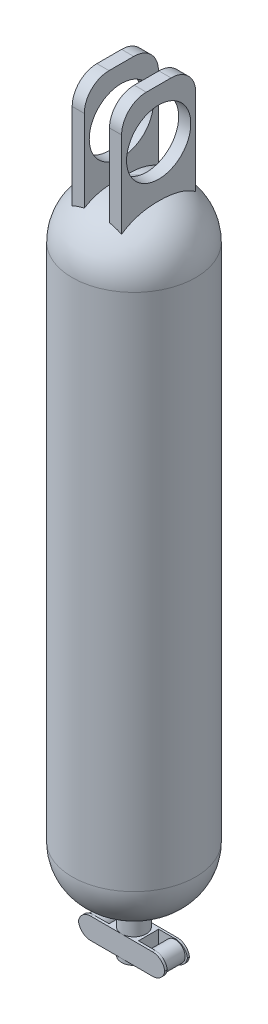
from build123d import *

# Parameters (mm, degrees)
SKETCH1_R           = 2.5
BOSS_EXTRUDE1_DEPTH = 25
SKETCH2_W           = 2
SKETCH2_H           = 3
SKETCH2_W_2         = 1
SKETCH2_H_2         = 2
BOSS_EXTRUDE2_DEPTH = 4
SKETCH3_W           = 1.019035956
SKETCH3_H           = 3.229242318
CUT_EXTRUDE1_DEPTH  = 4
SKETCH4_R           = 1.3
CUT_EXTRUDE2_DEPTH  = 4
FILLET1_R           = 1
FILLET2_R           = 2
SKETCH5_R           = 0.5
BOSS_EXTRUDE3_DEPTH = 2
SKETCH6_W           = 3.503526818
SKETCH6_H           = 0.85884316
BOSS_EXTRUDE4_DEPTH = 0.5
FILLET3_R           = 0.5
SKETCH7_W           = 0.309208581
SKETCH7_H           = 0.81541506
CUT_EXTRUDE6_DEPTH  = 1
LPATTERN1_COUNT     = 2
LPATTERN1_PITCH     = 1.5
FILLET4_R           = 0.5
CUT_EXTRUDE8_DEPTH  = 1
CUT_EXTRUDE9_DEPTH  = 1
SKETCH12_R          = 0.4
BOSS_EXTRUDE5_DEPTH = 1
SKETCH13_R          = 0.4
BOSS_EXTRUDE6_DEPTH = 1


with BuildPart() as part:
    # Sketch1 → Boss-Extrude1 (new body)
    with BuildSketch(Plane(origin=(0, 0, 0), x_dir=(1, 0, 0), z_dir=(0, 1, 0))):
        with Locations(Location((0, 0, 0), (0, 0, 270))):
            Circle(SKETCH1_R)
    extrude(amount=BOSS_EXTRUDE1_DEPTH)

    # Sketch2 → Boss-Extrude2 (add)
    with BuildSketch(Plane(origin=(0, 25, 0), x_dir=(1, 0, 0), z_dir=(0, 1, 0))):
        Rectangle(SKETCH2_W, SKETCH2_H)
        Rectangle(SKETCH2_W_2, SKETCH2_H_2, mode=Mode.SUBTRACT)
    extrude(amount=BOSS_EXTRUDE2_DEPTH)

    # Sketch3 → Cut-Extrude1 (cut)
    with BuildSketch(Plane(origin=(0, 29, 0), x_dir=(1, 0, 0), z_dir=(0, 1, 0))):
        Rectangle(SKETCH3_W, SKETCH3_H)
    extrude(amount=-CUT_EXTRUDE1_DEPTH, mode=Mode.SUBTRACT)

    # Sketch4 → Cut-Extrude2 (cut)
    with BuildSketch(Plane.ZY.offset(1)):
        with Locations((0, 27)):
            Circle(SKETCH4_R)
    extrude(amount=-CUT_EXTRUDE2_DEPTH, mode=Mode.SUBTRACT)

    # Fillet1
    fillet1_edges = [part.edges().sort_by_distance(p)[0] for p in [
        (-0.754758989, 29, 1.5),
        (0.754758989, 29, -1.5),
        (-0.754758989, 29, -1.5),
        (0.754758989, 29, 1.5),
    ]]
    fillet(fillet1_edges, radius=FILLET1_R)

    # Fillet2
    # the kernel refuses this fillet: 2 mm, written as the material it takes off along each edge
    with BuildSketch(Plane(origin=(0, 0, 0), x_dir=(0, 0, 1), z_dir=(-1, 0, 0))) as fillet2_piece_1:
        with BuildLine():
            CenterArc((2.5 - FILLET2_R, FILLET2_R), FILLET2_R, 270, 90)
            Line((2.5 - FILLET2_R, 0), (2.5, 0))
            Line((2.5, 0), (2.5, FILLET2_R))
        make_face()
    revolve(axis=Axis((0, 0, 0), (0, 1, 0)), mode=Mode.SUBTRACT)
    with BuildSketch(Plane(origin=(0, 25, 0), x_dir=(0, 0, 1), z_dir=(-1, 0, 0))) as fillet2_piece_2_section:
        with BuildLine():
            CenterArc((2.5 - FILLET2_R, -FILLET2_R), FILLET2_R, 0, 90)
            Line((2.5, -FILLET2_R), (2.5, 0))
            Line((2.5, 0), (2.5 - FILLET2_R, 0))
        make_face()
    fillet2_piece_2 = revolve(axis=Axis((0, 25, 0), (0, 1, 0)), mode=Mode.PRIVATE)
    fillet2_piece_2 = split(fillet2_piece_2, bisect_by=Plane(origin=(0.509517978, 24.924108372, -1.066767337), z_dir=(-1, 0, 0)), keep=Keep.TOP, mode=Mode.PRIVATE)
    fillet2_piece_2 = split(fillet2_piece_2, bisect_by=Plane(origin=(-0.509517978, 24.924108372, -1.066767337), z_dir=(1, 0, 0)), keep=Keep.TOP, mode=Mode.PRIVATE)
    add(fillet2_piece_2, mode=Mode.SUBTRACT)
    with BuildSketch(Plane(origin=(0, 25, 0), x_dir=(0, 0, 1), z_dir=(-1, 0, 0))) as fillet2_piece_3_section:
        with BuildLine():
            CenterArc((2.5 - FILLET2_R, -FILLET2_R), FILLET2_R, 0, 90)
            Line((2.5, -FILLET2_R), (2.5, 0))
            Line((2.5, 0), (2.5 - FILLET2_R, 0))
        make_face()
    fillet2_piece_3 = revolve(axis=Axis((0, 25, 0), (0, 1, 0)), mode=Mode.PRIVATE)
    fillet2_piece_3 = split(fillet2_piece_3, bisect_by=Plane(origin=(0.753348396, 24.487146264, 1.5), z_dir=(0, 0, 1)), keep=Keep.TOP, mode=Mode.PRIVATE)
    add(fillet2_piece_3, mode=Mode.SUBTRACT)
    with BuildSketch(Plane(origin=(0, 25, 0), x_dir=(0, 0, 1), z_dir=(-1, 0, 0))) as fillet2_piece_4_section:
        with BuildLine():
            CenterArc((2.5 - FILLET2_R, -FILLET2_R), FILLET2_R, 0, 90)
            Line((2.5, -FILLET2_R), (2.5, 0))
            Line((2.5, 0), (2.5 - FILLET2_R, 0))
        make_face()
    fillet2_piece_4 = revolve(axis=Axis((0, 25, 0), (0, 1, 0)), mode=Mode.PRIVATE)
    fillet2_piece_4 = split(fillet2_piece_4, bisect_by=Plane(origin=(1, 24.532221184, 1.15e-07), z_dir=(1, 0, 0)), keep=Keep.TOP, mode=Mode.PRIVATE)
    add(fillet2_piece_4, mode=Mode.SUBTRACT)
    with BuildSketch(Plane(origin=(0, 25, 0), x_dir=(0, 0, 1), z_dir=(-1, 0, 0))) as fillet2_piece_5_section:
        with BuildLine():
            CenterArc((2.5 - FILLET2_R, -FILLET2_R), FILLET2_R, 0, 90)
            Line((2.5, -FILLET2_R), (2.5, 0))
            Line((2.5, 0), (2.5 - FILLET2_R, 0))
        make_face()
    fillet2_piece_5 = revolve(axis=Axis((0, 25, 0), (0, 1, 0)), mode=Mode.PRIVATE)
    fillet2_piece_5 = split(fillet2_piece_5, bisect_by=Plane(origin=(0.753348395, 24.487146008, -1.5), z_dir=(0, 0, -1)), keep=Keep.TOP, mode=Mode.PRIVATE)
    add(fillet2_piece_5, mode=Mode.SUBTRACT)
    with BuildSketch(Plane(origin=(0, 25, 0), x_dir=(0, 0, 1), z_dir=(-1, 0, 0))) as fillet2_piece_6_section:
        with BuildLine():
            CenterArc((2.5 - FILLET2_R, -FILLET2_R), FILLET2_R, 0, 90)
            Line((2.5, -FILLET2_R), (2.5, 0))
            Line((2.5, 0), (2.5 - FILLET2_R, 0))
        make_face()
    fillet2_piece_6 = revolve(axis=Axis((0, 25, 0), (0, 1, 0)), mode=Mode.PRIVATE)
    fillet2_piece_6 = split(fillet2_piece_6, bisect_by=Plane(origin=(-1, 24.532221184, -1.16e-07), z_dir=(-1, 0, 0)), keep=Keep.TOP, mode=Mode.PRIVATE)
    add(fillet2_piece_6, mode=Mode.SUBTRACT)

    # Sketch5 → Boss-Extrude3 (add)
    with BuildSketch(Plane(origin=(0, 0, 0), x_dir=(1, 0, 0), z_dir=(0, 1, 0))):
        with Locations(Location((0, 0, 0), (0, 0, 270))):
            Circle(SKETCH5_R)
    extrude(amount=-BOSS_EXTRUDE3_DEPTH)

    # Sketch6 → Boss-Extrude4 (add, symmetric)
    with BuildSketch(Plane.XY):
        with Locations((0, -1.427875915)):
            Rectangle(SKETCH6_W, SKETCH6_H)
    extrude(amount=BOSS_EXTRUDE4_DEPTH, both=True)

    # Fillet3
    # the kernel refuses this fillet: 0.5 mm, written as the material it takes off along each edge
    with BuildSketch(Plane(origin=(1.751763409, -0.998454335, 1.75), x_dir=(-1, 0, 0), z_dir=(0, 0, -1)), Plane(origin=(1.751763409, -1.857297495, 1.75), x_dir=(0, 1, 0), z_dir=(0, 0, -1)), Plane(origin=(-1.751763409, -0.998454335, -1.75), x_dir=(1, 0, 0), z_dir=(0, 0, 1)), Plane(origin=(-1.751763409, -1.857297495, -1.75), x_dir=(0, 1, 0), z_dir=(0, 0, 1))) as fillet3_piece_1:
        with BuildLine():
            CenterArc((FILLET3_R, -FILLET3_R), FILLET3_R, 90, 90)
            Line((0, -FILLET3_R), (0, 0))
            Line((0, 0), (FILLET3_R, 0))
        make_face()
    extrude(amount=3.5, mode=Mode.SUBTRACT)

    # Sketch7 → Cut-Extrude6 (cut)
    with BuildSketch(Plane.XZ.offset(1.857297495)):
        with Locations((-0.76394551, -0.009835432)):
            Rectangle(SKETCH7_W, SKETCH7_H)
    cut_extrude6 = extrude(amount=-CUT_EXTRUDE6_DEPTH, mode=Mode.SUBTRACT)

    # LPattern1: Cut-Extrude6 ×2
    with Locations(*[(i * LPATTERN1_PITCH, 0, 0) for i in range(1, LPATTERN1_COUNT)]):
        add(cut_extrude6, mode=Mode.SUBTRACT)

    # Fillet4
    # the kernel refuses this fillet: 0.5 mm, written as the material it adds along each edge
    # the kernel refuses this fillet: 0.5 mm, written as the material it takes off along each edge
    with BuildSketch(Plane(origin=(-0.9185498, -0.998454335, -0.417542962), x_dir=(-1, 0, 0), z_dir=(0, 0, 1)), Plane(origin=(-0.9185498, -1.857297495, -0.417542962), x_dir=(0, 1, 0), z_dir=(0, 0, 1)), Plane(origin=(0.890658781, -0.998454335, 0.397872098), x_dir=(1, 0, 0), z_dir=(0, 0, -1)), Plane(origin=(0.890658781, -1.857297495, 0.397872098), x_dir=(0, 1, 0), z_dir=(0, 0, -1))) as fillet4_2_piece_1:
        with BuildLine():
            CenterArc((FILLET4_R, FILLET4_R), FILLET4_R, 180, 90)
            Line((0, FILLET4_R), (0, 0))
            Line((0, 0), (FILLET4_R, 0))
        make_face()
    extrude(amount=0.81541506, mode=Mode.SUBTRACT)

    # Sketch10 → Cut-Extrude8 (cut)
    with BuildSketch(Plane.XZ.offset(1.857297495)):
        Polygon((-0.923556177, 0.397872098), (-1.784787166, 0.397872098), (-1.784787166, -0.417542962), (-0.876989159, -0.417542962), (-0.876989159, 0.397872098), align=None)
    extrude(amount=-CUT_EXTRUDE8_DEPTH, mode=Mode.SUBTRACT)

    # Sketch11 → Cut-Extrude9 (cut)
    with BuildSketch(Plane(origin=(0, -1.857297495, 0), x_dir=(-1, 0, 0), z_dir=(0, -1, 0))):
        Polygon((-0.741652452, -0.397872098), (-1.858092241, -0.397872098), (-1.858092241, 0.417542962), (-0.783282411, 0.417542962), align=None)
    extrude(amount=-CUT_EXTRUDE9_DEPTH, mode=Mode.SUBTRACT)

    # Sketch12 → Boss-Extrude5 (add)
    with BuildSketch(Plane.XY.offset(0.5)):
        with Locations((-1.251763409, -1.427875915)):
            Circle(SKETCH12_R)
    extrude(amount=-BOSS_EXTRUDE5_DEPTH)

    # Sketch13 → Boss-Extrude6 (add)
    with BuildSketch(Plane.XY.offset(0.5)):
        with Locations((1.251763409, -1.427875915)):
            Circle(SKETCH13_R)
    extrude(amount=-BOSS_EXTRUDE6_DEPTH)


solid = part.part
